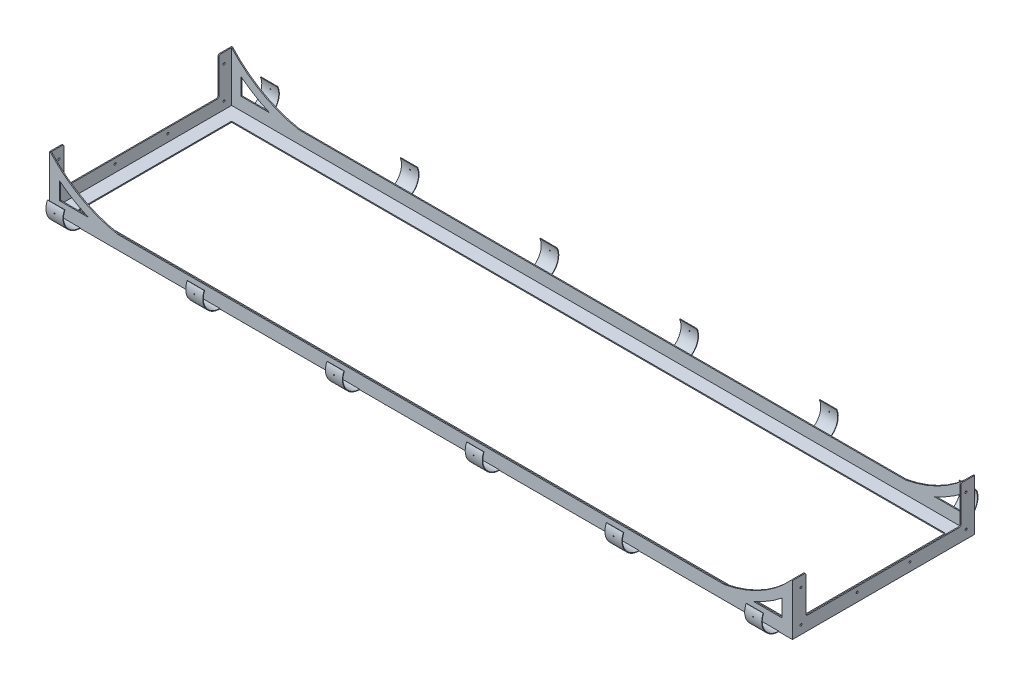
from build123d import *

# Parameters (mm, degrees)
SKETCH1_W               = 2180
SKETCH1_H               = 534.64
SKETCH1_W_2             = 2174
SKETCH1_H_2             = 528.64
BOSS_EXTRUDE1_DEPTH     = 40
SKETCH1_3_W             = 2174
SKETCH1_3_H             = 528.64
SKETCH1_3_W_2           = 2094
SKETCH1_3_H_2           = 448.64
BOSS_EXTRUDE2_DEPTH     = 3
SKETCH2_R               = 3
CUT_EXTRUDE1_DEPTH      = 3241
LPATTERN1_COUNT         = 2
LPATTERN1_PITCH         = 165
MIRROR1_COPY_1_SKETCH_R = 3
MIRROR1_COPY_1_DEPTH    = 3241
BOSS_EXTRUDE3_DEPTH     = 3
SKETCH3_3_W             = 3
SKETCH3_3_H             = 110
BOSS_EXTRUDE4_DEPTH     = 40
FILLET1_R               = 5
SKETCH4_R               = 3
CUT_EXTRUDE2_DEPTH      = 40
FILLET1_OF_MIRROR4_R    = 5
THICKEN1_START          = 1000
THICKEN1_DEPTH          = 50
LPATTERN5_COUNT         = 6
LPATTERN5_PITCH         = 410
MIRROR6_START           = 1000
MIRROR6_COPY_1_DEPTH    = 50
MIRROR6_COPY_2_DEPTH    = 50
MIRROR6_COPY_3_DEPTH    = 50
MIRROR6_COPY_4_DEPTH    = 50
MIRROR6_COPY_5_DEPTH    = 50
SKETCH6_R               = 1.5
CUT_EXTRUDE3_DEPTH      = 50
LPATTERN6_COUNT         = 6
LPATTERN6_PITCH         = 410
MIRROR7_COPY_1_SKETCH_R = 1.5
MIRROR7_COPY_1_DEPTH    = 50
MIRROR7_COPY_2_SKETCH_R = 1.5
MIRROR7_COPY_2_DEPTH    = 50
MIRROR7_COPY_3_SKETCH_R = 1.5
MIRROR7_COPY_3_DEPTH    = 50
MIRROR7_COPY_4_SKETCH_R = 1.5
MIRROR7_COPY_4_DEPTH    = 50
MIRROR7_COPY_5_SKETCH_R = 1.5
MIRROR7_COPY_5_DEPTH    = 50


# Read off the part's stored shape, not the designer's step: Mirror5, Thicken1
with BuildPart() as part:
    # Sketch1 → Boss-Extrude1 (new body)
    with BuildSketch(Plane(origin=(0, 0, 0), x_dir=(1, 0, 0), z_dir=(0, 1, 0))):
        Rectangle(SKETCH1_W, SKETCH1_H)
        Rectangle(SKETCH1_W_2, SKETCH1_H_2, mode=Mode.SUBTRACT)
    extrude(amount=BOSS_EXTRUDE1_DEPTH)

    # Sketch1<3> → Boss-Extrude2 (add)
    with BuildSketch(Plane(origin=(0, 0, 0), x_dir=(1, 0, 0), z_dir=(0, 1, 0))):
        Rectangle(SKETCH1_3_W, SKETCH1_3_H)
        Rectangle(SKETCH1_3_W_2, SKETCH1_3_H_2, mode=Mode.SUBTRACT)
    extrude(amount=BOSS_EXTRUDE2_DEPTH)

    # Sketch2 → Cut-Extrude1 (cut)
    with BuildSketch(Plane(origin=(1090, 0, 0), x_dir=(0, 0, -1), z_dir=(1, 0, 0))):
        with Locations((-242.32, 25)):
            Circle(SKETCH2_R)
    cut_extrude1 = extrude(amount=-CUT_EXTRUDE1_DEPTH, mode=Mode.SUBTRACT)

    # LPattern1: Cut-Extrude1 ×2
    with Locations(*[(0, 0, -i * LPATTERN1_PITCH) for i in range(1, LPATTERN1_COUNT)]):
        add(cut_extrude1, mode=Mode.SUBTRACT)

    # Mirror1: Cut-Extrude1 across plane
    add(cut_extrude1.mirror(Plane.XY), mode=Mode.SUBTRACT)

    # Mirror1 copy 1 sketch → Mirror1 copy 1 (cut)
    with BuildSketch(Plane(origin=(1090, 0, 165), x_dir=(0, 0, 1), z_dir=(1, 0, 0))):
        with Locations((-242.32, -25)):
            Circle(MIRROR1_COPY_1_SKETCH_R)
    extrude(amount=-MIRROR1_COPY_1_DEPTH, mode=Mode.SUBTRACT)

    # Sketch3 → Boss-Extrude3 (add)
    with BuildSketch(Plane.XY.offset(267.32)):
        with BuildLine():
            Line((-1087, 150), (-1087, 40))
            Line((-1087, 40), (-1060, 40))
            Line((-1060, 40), (-1060, 90.469344805))
            ThreePointArc((-1060, 90.469344805), (-1019.473902715, 62.457542419), (-975.625477172, 40))
            Line((-975.625477172, 40), (-890, 40))
            ThreePointArc((-890, 40), (-997.607077331, 78.690052416), (-1087, 150))
        make_face()
    boss_extrude3 = extrude(amount=-BOSS_EXTRUDE3_DEPTH)

    # Sketch3<3> → Boss-Extrude4 (add)
    with BuildSketch(Plane.XY.offset(267.32)):
        with Locations((-1088.5, 95)):
            Rectangle(SKETCH3_3_W, SKETCH3_3_H)
    boss_extrude4 = extrude(amount=-BOSS_EXTRUDE4_DEPTH)

    # Fillet1
    fillet1_edges = [part.edges().sort_by_distance(p)[0] for p in [
        (-1088.5, 40, 227.32),
        (-1088.5, 150, 227.32),
    ]]
    fillet(fillet1_edges, radius=FILLET1_R)

    # Sketch4 → Cut-Extrude2 (cut)
    with BuildSketch(Plane.ZY.offset(1090)):
        with Locations((242.32, 120)):
            Circle(SKETCH4_R)
    cut_extrude2 = extrude(amount=-CUT_EXTRUDE2_DEPTH, mode=Mode.SUBTRACT)

    # Mirror4: Boss-Extrude3, Boss-Extrude4, Cut-Extrude2 across plane
    add(boss_extrude3.mirror(Plane(origin=(0, 0, 0), x_dir=(0, 0, 1), z_dir=(1, 0, 0))))
    add(boss_extrude4.mirror(Plane(origin=(0, 0, 0), x_dir=(0, 0, 1), z_dir=(1, 0, 0))))
    add(cut_extrude2.mirror(Plane(origin=(0, 0, 0), x_dir=(0, 0, 1), z_dir=(1, 0, 0))), mode=Mode.SUBTRACT)

    # Fillet1 of Mirror4
    fillet1_of_mirror4_edges = [part.edges().sort_by_distance(p)[0] for p in [
        (1088.5, 40, 227.32),
        (1088.5, 150, 227.32),
    ]]
    fillet(fillet1_of_mirror4_edges, radius=FILLET1_OF_MIRROR4_R)

    # Mirror5: part across plane


with BuildPart() as part_1:
    add(part.part)
    add(part.part.mirror(Plane.XY))

    # Thicken1 outline → Thicken1 (add)
    with BuildSketch(Plane.YZ.offset(THICKEN1_START)):
        with BuildLine():
            Line((70, -313.14575695), (69.4, -311.770984241))
            ThreePointArc((69.4, -311.770984241), (23.435455961, -307.898011287), (1.5, -267.32))
            Line((1.5, -267.32), (0, -267.32))
            ThreePointArc((0, -267.32), (22.613872125, -309.153001327), (70, -313.14575695))
        make_face()
    thicken1 = extrude(amount=THICKEN1_DEPTH)

    # LPattern5: Thicken1 ×6
    with Locations(*[(-i * LPATTERN5_PITCH, 0, 0) for i in range(1, LPATTERN5_COUNT)]):
        add(thicken1)

    # Mirror6: Thicken1 across plane
    add(thicken1.mirror(Plane.XY))

    # Mirror6 copy 1 sketch → Mirror6 copy 1 (add)
    with BuildSketch(Plane.YZ.offset(-410).offset(MIRROR6_START)):
        with BuildLine():
            Line((70, 313.14575695), (69.4, 311.770984241))
            ThreePointArc((69.4, 311.770984241), (23.435455961, 307.898011287), (1.5, 267.32))
            Line((1.5, 267.32), (0, 267.32))
            ThreePointArc((0, 267.32), (22.613872125, 309.153001327), (70, 313.14575695))
        make_face()
    extrude(amount=MIRROR6_COPY_1_DEPTH)

    # Mirror6 copy 2 sketch → Mirror6 copy 2 (add)
    with BuildSketch(Plane.YZ.offset(-820).offset(MIRROR6_START)):
        with BuildLine():
            Line((70, 313.14575695), (69.4, 311.770984241))
            ThreePointArc((69.4, 311.770984241), (23.435455961, 307.898011287), (1.5, 267.32))
            Line((1.5, 267.32), (0, 267.32))
            ThreePointArc((0, 267.32), (22.613872125, 309.153001327), (70, 313.14575695))
        make_face()
    extrude(amount=MIRROR6_COPY_2_DEPTH)

    # Mirror6 copy 3 sketch → Mirror6 copy 3 (add)
    with BuildSketch(Plane.YZ.offset(-1230).offset(MIRROR6_START)):
        with BuildLine():
            Line((70, 313.14575695), (69.4, 311.770984241))
            ThreePointArc((69.4, 311.770984241), (23.435455961, 307.898011287), (1.5, 267.32))
            Line((1.5, 267.32), (0, 267.32))
            ThreePointArc((0, 267.32), (22.613872125, 309.153001327), (70, 313.14575695))
        make_face()
    extrude(amount=MIRROR6_COPY_3_DEPTH)

    # Mirror6 copy 4 sketch → Mirror6 copy 4 (add)
    with BuildSketch(Plane.YZ.offset(-1640).offset(MIRROR6_START)):
        with BuildLine():
            Line((70, 313.14575695), (69.4, 311.770984241))
            ThreePointArc((69.4, 311.770984241), (23.435455961, 307.898011287), (1.5, 267.32))
            Line((1.5, 267.32), (0, 267.32))
            ThreePointArc((0, 267.32), (22.613872125, 309.153001327), (70, 313.14575695))
        make_face()
    extrude(amount=MIRROR6_COPY_4_DEPTH)

    # Mirror6 copy 5 sketch → Mirror6 copy 5 (add)
    with BuildSketch(Plane.YZ.offset(-2050).offset(MIRROR6_START)):
        with BuildLine():
            Line((70, 313.14575695), (69.4, 311.770984241))
            ThreePointArc((69.4, 311.770984241), (23.435455961, 307.898011287), (1.5, 267.32))
            Line((1.5, 267.32), (0, 267.32))
            ThreePointArc((0, 267.32), (22.613872125, 309.153001327), (70, 313.14575695))
        make_face()
    extrude(amount=MIRROR6_COPY_5_DEPTH)

    # Sketch6 → Cut-Extrude3 (cut)
    with BuildSketch(Plane(origin=(0, 0, -267.32), x_dir=(-1, 0, 0), z_dir=(0, 0, -1))):
        with Locations(Location((1025, 50, 0), (0, 0, 180))):
            Circle(SKETCH6_R)
    cut_extrude3 = extrude(amount=CUT_EXTRUDE3_DEPTH, mode=Mode.SUBTRACT)

    # LPattern6: Cut-Extrude3 ×6
    with Locations(*[(i * LPATTERN6_PITCH, 0, 0) for i in range(1, LPATTERN6_COUNT)]):
        add(cut_extrude3, mode=Mode.SUBTRACT)

    # Mirror7: Cut-Extrude3 across plane
    add(cut_extrude3.mirror(Plane.XY), mode=Mode.SUBTRACT)

    # Mirror7 copy 1 sketch → Mirror7 copy 1 (cut)
    with BuildSketch(Plane(origin=(410, 0, 267.32), x_dir=(-1, 0, 0), z_dir=(0, 0, 1))):
        with Locations((1025, -50)):
            Circle(MIRROR7_COPY_1_SKETCH_R)
    extrude(amount=MIRROR7_COPY_1_DEPTH, mode=Mode.SUBTRACT)

    # Mirror7 copy 2 sketch → Mirror7 copy 2 (cut)
    with BuildSketch(Plane(origin=(820, 0, 267.32), x_dir=(-1, 0, 0), z_dir=(0, 0, 1))):
        with Locations((1025, -50)):
            Circle(MIRROR7_COPY_2_SKETCH_R)
    extrude(amount=MIRROR7_COPY_2_DEPTH, mode=Mode.SUBTRACT)

    # Mirror7 copy 3 sketch → Mirror7 copy 3 (cut)
    with BuildSketch(Plane(origin=(1230, 0, 267.32), x_dir=(-1, 0, 0), z_dir=(0, 0, 1))):
        with Locations((1025, -50)):
            Circle(MIRROR7_COPY_3_SKETCH_R)
    extrude(amount=MIRROR7_COPY_3_DEPTH, mode=Mode.SUBTRACT)

    # Mirror7 copy 4 sketch → Mirror7 copy 4 (cut)
    with BuildSketch(Plane(origin=(1640, 0, 267.32), x_dir=(-1, 0, 0), z_dir=(0, 0, 1))):
        with Locations((1025, -50)):
            Circle(MIRROR7_COPY_4_SKETCH_R)
    extrude(amount=MIRROR7_COPY_4_DEPTH, mode=Mode.SUBTRACT)

    # Mirror7 copy 5 sketch → Mirror7 copy 5 (cut)
    with BuildSketch(Plane(origin=(2050, 0, 267.32), x_dir=(-1, 0, 0), z_dir=(0, 0, 1))):
        with Locations((1025, -50)):
            Circle(MIRROR7_COPY_5_SKETCH_R)
    extrude(amount=MIRROR7_COPY_5_DEPTH, mode=Mode.SUBTRACT)


solid = part_1.part
